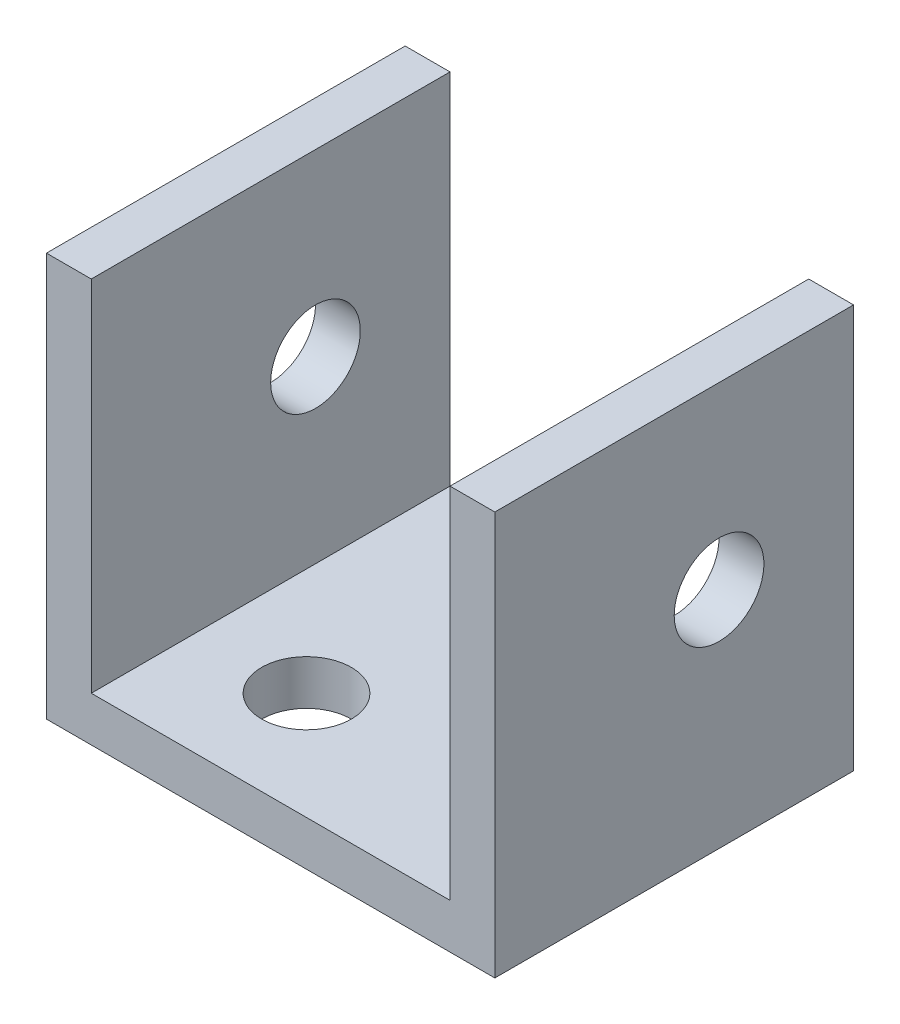
from build123d import *

# Parameters (mm, degrees)
SKETCH1_W                   = 31.75
SKETCH1_H                   = 25.4
BOSS_EXTRUDE1_DEPTH         = 3.175
SKETCH2_W                   = 3.175
SKETCH2_H                   = 25.4
BOSS_EXTRUDE2_DEPTH         = 25.4
F_1_4_0_25_DIAMETER_HOLE1_D = 6.35
F_1_4_0_25_DIAMETER_HOLE2_D = 6.35


with BuildPart() as part:
    # Sketch1 → Boss-Extrude1 (new body)
    with BuildSketch(Plane(origin=(0, 0, 0), x_dir=(1, 0, 0), z_dir=(0, 1, 0))):
        Rectangle(SKETCH1_W, SKETCH1_H)
    extrude(amount=BOSS_EXTRUDE1_DEPTH)

    # Sketch2 → Boss-Extrude2 (add)
    with BuildSketch(Plane(origin=(0, 3.175, 0), x_dir=(1, 0, 0), z_dir=(0, 1, 0))):
        with Locations((-14.2875, 0)):
            Rectangle(SKETCH2_W, SKETCH2_H)
        with Locations((14.2875, 0)):
            Rectangle(SKETCH2_W, SKETCH2_H)
    extrude(amount=BOSS_EXTRUDE2_DEPTH)

    # 1/4 (0.25) Diameter Hole1 (through all)
    with Locations(Plane(origin=(0, 3.175, 0), x_dir=(1, 0, 0), z_dir=(0, 1, 0))):
        with Locations((5.08, 5.08), (-5.08, -5.08)):
            Hole(F_1_4_0_25_DIAMETER_HOLE1_D / 2)

    # 1/4 (0.25) Diameter Hole2 (through all)
    with Locations(Plane.ZY.offset(15.875)):
        with Locations((-3.175, 15.875)):
            Hole(F_1_4_0_25_DIAMETER_HOLE2_D / 2)


solid = part.part
